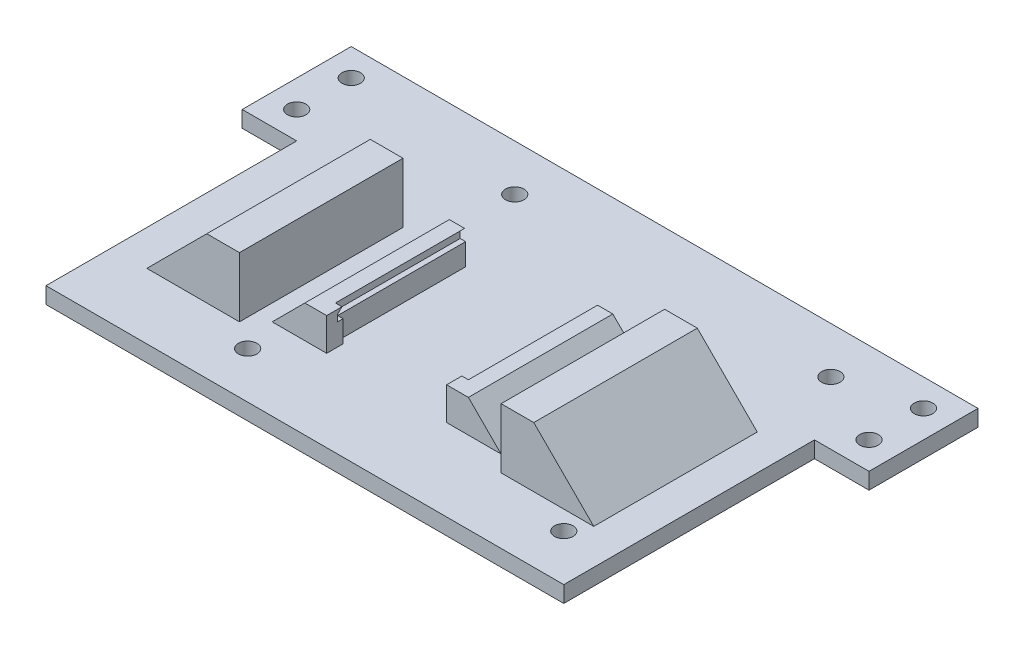
from build123d import *

# Parameters (mm, degrees)
BOSS_EXTRUDE1_DEPTH  = 3
M3_CLEARANCE_HOLE1_D = 3.4
M3_CLEARANCE_HOLE2_D = 3.4
EXTRUDE_THIN1_DEPTH  = 6
SKETCH9_W            = 1
SKETCH9_H            = 1.2
CHAMFER1_SIZE        = 1
SKETCH11_W           = 22
SKETCH11_H           = 3
CUT_EXTRUDE1_DEPTH   = 6
SKETCH12_W           = 6
SKETCH12_H           = 30
BOSS_EXTRUDE3_DEPTH  = 11
CHAMFER2_SIZE        = 6
CHAMFER3_SIZE        = 11


# Some blends are built 0.0001 mm under size
with BuildPart() as part:
    # Sketch1 → Boss-Extrude1 (new body)
    with BuildSketch(Plane(origin=(0, 0, 0), x_dir=(1, 0, 0), z_dir=(0, 1, 0))):
        Polygon((-57.5, 33), (-57.5, 13), (-47.5, 13), (-47.5, -33), (47.5, -33), (47.5, 13), (57.5, 13), (57.5, 33), align=None)
    extrude(amount=BOSS_EXTRUDE1_DEPTH)

    # M3 Clearance Hole1 (through all)
    with Locations(Plane(origin=(0, 3, 0), x_dir=(1, 0, 0), z_dir=(0, 1, 0))):
        with Locations((-52.5, 28), (-52.5, 18), (52.5, 28), (52.5, 18)):
            Hole(M3_CLEARANCE_HOLE1_D / 2)

    # M3 Clearance Hole2 (through all)
    with Locations(Plane(origin=(0, 3, 0), x_dir=(1, 0, 0), z_dir=(0, 1, 0))):
        with Locations((-19, 24.5), (-19, -24.5), (39, -24.5), (39, 24.5)):
            Hole(M3_CLEARANCE_HOLE2_D / 2)

    # Sketch8 → Extrude-Thin1 (add)
    with BuildSketch(Plane(origin=(0, 3, 0), x_dir=(1, 0, 0), z_dir=(0, 1, 0))):
        Polygon((-12, 8.5), (-12, -15), (12, -15), (12, 8.5), (15, 8.5), (15, -18), (-15, -18), (-15, 8.5), align=None)
    extrude(amount=EXTRUDE_THIN1_DEPTH)

    # Cut-Sweep1: sweep along a path in Sketch10
    with BuildLine(Plane(origin=(0, 7.6, 0), x_dir=(1, 0, 0), z_dir=(0, 1, 0))) as cut_sweep1_path:
        Line((12, 8.5), (12, -15))
        Line((12, -15), (-12, -15))
        Line((-12, -15), (-12, 8.5))
    # Sketch9 → Cut-Sweep1 (sweep, cut)
    with BuildSketch(Plane(origin=(0, 0, -8.5), x_dir=(-1, 0, 0), z_dir=(0, 0, -1))):
        with Locations((-12.5, 7.6)):
            Rectangle(SKETCH9_W, SKETCH9_H)
    sweep(path=cut_sweep1_path.line, transition=Transition.RIGHT, mode=Mode.SUBTRACT)

    # Chamfer1
    # the kernel refuses this chamfer: 1 mm, written as the material it takes off along each edge
    with BuildSketch(Plane(origin=(-12, 8.2, 15), x_dir=(-0.9996219169112968, -0.0274958766105856, 0), z_dir=(0, 0, -1))) as chamfer1_piece_1_section:
        Polygon((CHAMFER1_SIZE * 0.999621916911, CHAMFER1_SIZE * 0.0274958766106), (-CHAMFER1_SIZE * 0.0274958766106, CHAMFER1_SIZE * 0.999621916911), (0, 0), align=None)
    chamfer1_piece_1 = extrude(amount=26.071682988, mode=Mode.PRIVATE)
    chamfer1_piece_1 = split(chamfer1_piece_1, bisect_by=Plane(origin=(-13, 8.530404154, 1.964158506), z_dir=(1, 0, 0)), keep=Keep.TOP, mode=Mode.PRIVATE)
    add(chamfer1_piece_1, mode=Mode.SUBTRACT)
    with BuildSketch(Plane(origin=(12, 8.2, 15), x_dir=(0, -0.0274958766105856, 0.9996219169112968), z_dir=(-1, 0, 0))) as chamfer1_piece_2_section:
        Polygon((CHAMFER1_SIZE * 0.999621916911, CHAMFER1_SIZE * 0.0274958766106), (-CHAMFER1_SIZE * 0.0274958766106, CHAMFER1_SIZE * 0.999621916911), (0, 0), align=None)
    chamfer1_piece_2 = extrude(amount=24, mode=Mode.PRIVATE)
    chamfer1_piece_2 = split(chamfer1_piece_2, bisect_by=Plane(origin=(0, 8.530404154, 16), z_dir=(0, 0, -1)), keep=Keep.TOP, mode=Mode.PRIVATE)
    add(chamfer1_piece_2, mode=Mode.SUBTRACT)
    with BuildSketch(Plane(origin=(12, 8.2, -11.071682988), x_dir=(0.9996219169112968, -0.027495876610585647, 0), z_dir=(0, 0, 1))) as chamfer1_piece_3_section:
        Polygon((CHAMFER1_SIZE * 0.999621916911, CHAMFER1_SIZE * 0.0274958766106), (-CHAMFER1_SIZE * 0.0274958766106, CHAMFER1_SIZE * 0.999621916911), (0, 0), align=None)
    chamfer1_piece_3 = extrude(amount=26.071682988, mode=Mode.PRIVATE)
    chamfer1_piece_3 = split(chamfer1_piece_3, bisect_by=Plane(origin=(13, 8.530404154, 1.964158506), z_dir=(-1, 0, 0)), keep=Keep.TOP, mode=Mode.PRIVATE)
    add(chamfer1_piece_3, mode=Mode.SUBTRACT)
    with BuildSketch(Plane(origin=(-12, 8.2, 17.571682988), x_dir=(-0.9996219169112968, -0.027495876610585647, 0), z_dir=(0, 0, -1))) as chamfer1_piece_4a_section:
        Polygon((CHAMFER1_SIZE * 0.999621916911, CHAMFER1_SIZE * 0.0274958766106), (-CHAMFER1_SIZE * 0.0274958766106, CHAMFER1_SIZE * 0.999621916911), (0, 0), align=None)
    chamfer1_piece_4a = extrude(amount=28.643365976, mode=Mode.PRIVATE)
    chamfer1_piece_4a = split(chamfer1_piece_4a, bisect_by=Plane(origin=(-13, 8.530404154, 15.5), z_dir=(1, 0, 0)), keep=Keep.TOP, mode=Mode.PRIVATE)
    chamfer1_piece_4a = split(chamfer1_piece_4a, bisect_by=Plane(origin=(-12.328634334, 8.530404154, 16), z_dir=(0, 0, -1)), keep=Keep.TOP, mode=Mode.PRIVATE)
    chamfer1_piece_4a = split(chamfer1_piece_4a, bisect_by=Plane(origin=(-12.328634334, 8.530404154, 15), z_dir=(0, 0, 1)), keep=Keep.TOP, mode=Mode.PRIVATE)
    with BuildSketch(Plane(origin=(12, 8.2, 15), x_dir=(0, -0.0274958766105856, 0.9996219169112968), z_dir=(-1, 0, 0))) as chamfer1_piece_4b_section:
        Polygon((CHAMFER1_SIZE * 0.999621916911, CHAMFER1_SIZE * 0.0274958766106), (-CHAMFER1_SIZE * 0.0274958766106, CHAMFER1_SIZE * 0.999621916911), (0, 0), align=None)
    chamfer1_piece_4b = extrude(amount=26.571682988, mode=Mode.PRIVATE)
    chamfer1_piece_4b = split(chamfer1_piece_4b, bisect_by=Plane(origin=(-13, 8.530404154, 15.328634334), z_dir=(1, 0, 0)), keep=Keep.TOP, mode=Mode.PRIVATE)
    chamfer1_piece_4b = split(chamfer1_piece_4b, bisect_by=Plane(origin=(-12.5, 8.530404154, 16), z_dir=(0, 0, -1)), keep=Keep.TOP, mode=Mode.PRIVATE)
    chamfer1_piece_4b = split(chamfer1_piece_4b, bisect_by=Plane(origin=(-12, 8.530404154, 15.328634334), z_dir=(-1, 0, 0)), keep=Keep.TOP, mode=Mode.PRIVATE)
    chamfer1_piece_4 = chamfer1_piece_4a & chamfer1_piece_4b
    add(chamfer1_piece_4, mode=Mode.SUBTRACT)
    with BuildSketch(Plane(origin=(12, 8.2, -11.071682988), x_dir=(0.9996219169112968, -0.027495876610585647, 0), z_dir=(0, 0, 1))) as chamfer1_piece_5a_section:
        Polygon((CHAMFER1_SIZE * 0.999621916911, CHAMFER1_SIZE * 0.0274958766106), (-CHAMFER1_SIZE * 0.0274958766106, CHAMFER1_SIZE * 0.999621916911), (0, 0), align=None)
    chamfer1_piece_5a = extrude(amount=28.643365976, mode=Mode.PRIVATE)
    chamfer1_piece_5a = split(chamfer1_piece_5a, bisect_by=Plane(origin=(13, 8.530404154, 15.5), z_dir=(-1, 0, 0)), keep=Keep.TOP, mode=Mode.PRIVATE)
    chamfer1_piece_5a = split(chamfer1_piece_5a, bisect_by=Plane(origin=(12.328634334, 8.530404154, 16), z_dir=(0, 0, -1)), keep=Keep.TOP, mode=Mode.PRIVATE)
    chamfer1_piece_5a = split(chamfer1_piece_5a, bisect_by=Plane(origin=(12.328634334, 8.530404154, 15), z_dir=(0, 0, 1)), keep=Keep.TOP, mode=Mode.PRIVATE)
    with BuildSketch(Plane(origin=(14.571682988, 8.2, 15), x_dir=(0, -0.0274958766105856, 0.9996219169112968), z_dir=(-1, 0, 0))) as chamfer1_piece_5b_section:
        Polygon((CHAMFER1_SIZE * 0.999621916911, CHAMFER1_SIZE * 0.0274958766106), (-CHAMFER1_SIZE * 0.0274958766106, CHAMFER1_SIZE * 0.999621916911), (0, 0), align=None)
    chamfer1_piece_5b = extrude(amount=26.571682988, mode=Mode.PRIVATE)
    chamfer1_piece_5b = split(chamfer1_piece_5b, bisect_by=Plane(origin=(13, 8.530404154, 15.328634334), z_dir=(-1, 0, 0)), keep=Keep.TOP, mode=Mode.PRIVATE)
    chamfer1_piece_5b = split(chamfer1_piece_5b, bisect_by=Plane(origin=(12.5, 8.530404154, 16), z_dir=(0, 0, -1)), keep=Keep.TOP, mode=Mode.PRIVATE)
    chamfer1_piece_5b = split(chamfer1_piece_5b, bisect_by=Plane(origin=(12, 8.530404154, 15.328634334), z_dir=(1, 0, 0)), keep=Keep.TOP, mode=Mode.PRIVATE)
    chamfer1_piece_5 = chamfer1_piece_5a & chamfer1_piece_5b
    add(chamfer1_piece_5, mode=Mode.SUBTRACT)

    # Sketch11 → Cut-Extrude1 (cut)
    with BuildSketch(Plane(origin=(0, 9, 0), x_dir=(1, 0, 0), z_dir=(0, 1, 0))):
        with Locations((0, -16.5)):
            Rectangle(SKETCH11_W, SKETCH11_H)
    extrude(amount=-CUT_EXTRUDE1_DEPTH, mode=Mode.SUBTRACT)

    # Sketch12 → Boss-Extrude3 (add)
    with BuildSketch(Plane(origin=(0, 3, 0), x_dir=(1, 0, 0), z_dir=(0, 1, 0))):
        with Locations((-27, -6)):
            Rectangle(SKETCH12_W, SKETCH12_H)
        with Locations((27, -6)):
            Rectangle(SKETCH12_W, SKETCH12_H)
    extrude(amount=BOSS_EXTRUDE3_DEPTH)

    # Chamfer2
    chamfer2_edges = [part.edges().sort_by_distance(p)[0] for p in [
        (15, 3, 4.75),
        (-15, 3, 4.75),
    ]]
    chamfer(chamfer2_edges, length=CHAMFER2_SIZE - 0.0001)  # a hair under: the kernel refuses the full size

    # Chamfer3
    chamfer3_edges = [part.edges().sort_by_distance(p)[0] for p in [
        (30, 3, 6),
        (-30, 3, 6),
    ]]
    chamfer(chamfer3_edges, length=CHAMFER3_SIZE - 0.0001)  # a hair under: the kernel refuses the full size


solid = part.part
